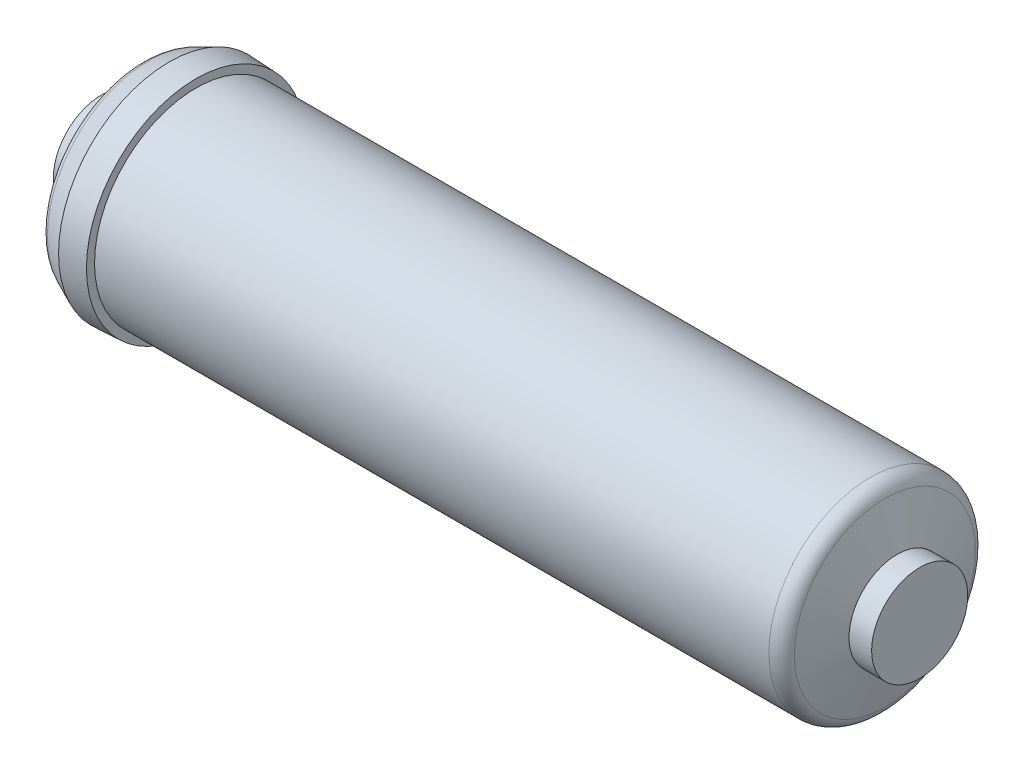
from build123d import *

# Parameters (mm, degrees)
FILLET1_R = 4.7625
SHELL1_T  = -2.54


with BuildPart() as part:
    # Sketch1 → Revolve1 (revolve)
    with BuildSketch(Plane.XY):
        Polygon((257.175, 0), (257.175, 15.113), (250.063, 15.113), (245.237, 31.877), (29.718, 31.877), (29.718, 34.417), (21.336, 34.798), (12.954, 30.988), (7.9502, 15.113), (0, 15.113), (0, 0), align=None)
    revolve(axis=Axis((0, 0, 0), (1, 0, 0)))

    # Fillet1
    fillet1_edges = [part.edges().sort_by_distance(p)[0] for p in [
        (12.954, -30.988, 0),
        (245.237, -31.877, 0),
    ]]
    fillet(fillet1_edges, radius=FILLET1_R)

    # Shell1
    shell1_openings = [part.faces().sort_by_distance(p)[0] for p in [
        (0, 0, 0),
    ]]
    offset(amount=SHELL1_T, openings=shell1_openings, kind=Kind.INTERSECTION)


solid = part.part
